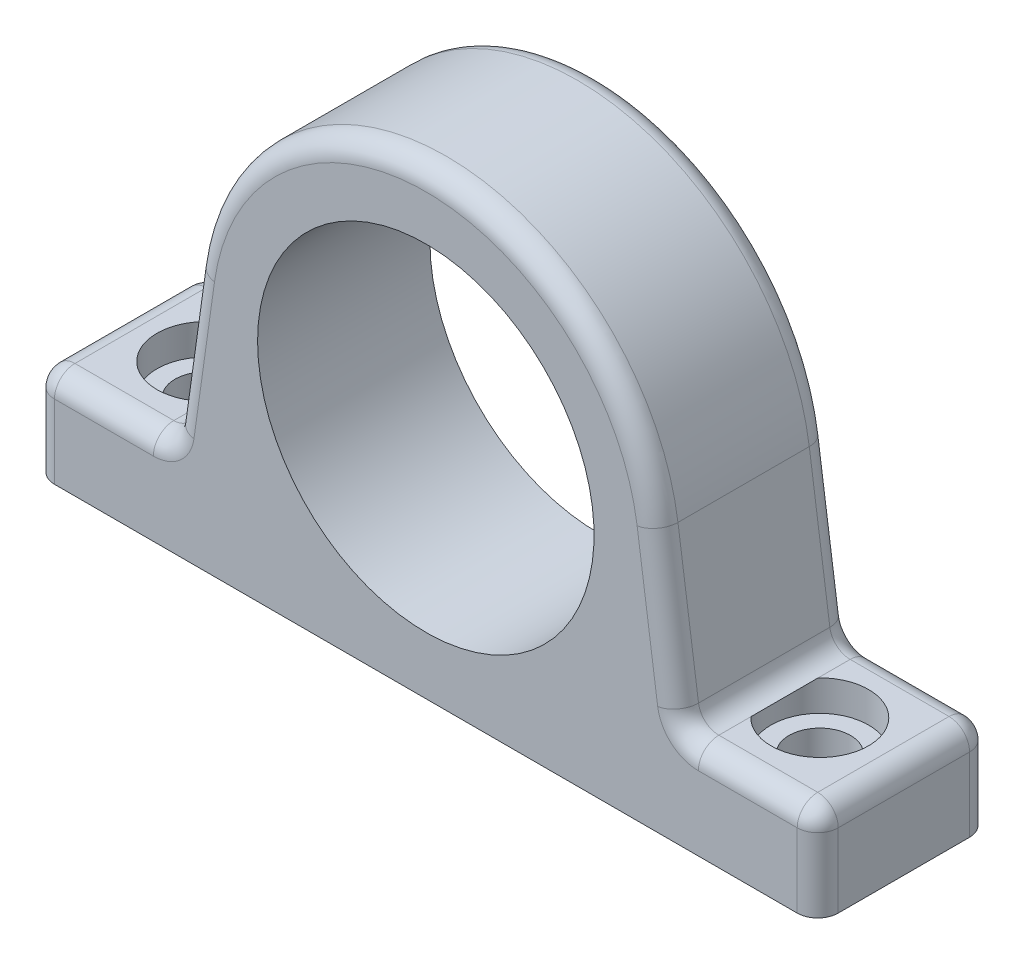
from build123d import *

# Parameters (mm, degrees)
BOSS_EXTRUDE1_DEPTH                        = 42
FILLET1_R                                  = 5
CBORE_FOR_M12_HEX_HEAD_BOLT2_OUTLINE_R     = 7.5
CBORE_FOR_M12_HEX_HEAD_BOLT2_DEPTH         = 23
CBORE_START                                = 15.5
CBORE_FOR_M12_HEX_HEAD_BOLT2_2_OUTLINE_R   = 11.8925
CBORE_FOR_M12_HEX_HEAD_BOLT2_2_OUTLINE_R_2 = 7.5
CBORE_FOR_M12_HEX_HEAD_BOLT2_2_DEPTH       = 7.5


# Read off the part's stored shape, not the designer's step: CBORE for M12 Hex Head Bolt2
with BuildPart() as part:
    # Sketch1 → Boss-Extrude1 (new body)
    with BuildSketch(Plane.XY):
        with BuildLine():
            Line((0, 0), (-95.5, 0))
            Line((-95.5, 0), (-95.5, 23))
            Line((-95.5, 23), (-62.057478344, 23))
            Line((-62.057478344, 23), (-56.445279918, 62.932866755))
            ThreePointArc((-56.445279918, 62.932866755), (-37.395364652, 98.018446073), (0, 112))
            Line((0, 112), (0, 96))
            ThreePointArc((0, 96), (-41, 55), (0, 14))
            Line((0, 14), (0, 0))
        make_face()
    boss_extrude1 = extrude(amount=BOSS_EXTRUDE1_DEPTH)

    # Mirror1: Boss-Extrude1 across plane
    add(boss_extrude1.mirror(Plane(origin=(0, 112, 42), x_dir=(0, 0, 1), z_dir=(-1, 0, 0))))

    # Fillet1
    fillet1_edges = [part.edges().sort_by_distance(p)[0] for p in [
        (0, 112, 0),
        (-95.5, 23, 21),
        (-62.057478344, 23, 21),
        (0, 112, 42),
        (-59.251379131, 42.966433377, 42),
        (95.5, 11.5, 42),
        (-78.778739172, 23, 42),
        (78.778739172, 23, 42),
        (95.5, 23, 21),
        (59.251379131, 42.966433377, 42),
        (62.057478344, 23, 21),
        (59.251379131, 42.966433377, 0),
        (78.778739172, 23, 0),
        (-95.5, 11.5, 42),
        (95.5, 11.5, 0),
        (-95.5, 11.5, 0),
        (-78.778739172, 23, 0),
        (-59.251379131, 42.966433377, 0),
    ]]
    fillet(fillet1_edges, radius=FILLET1_R)

    # CBORE for M12 Hex Head Bolt2 outline → CBORE for M12 Hex Head Bolt2 (cut)
    with BuildSketch(Plane(origin=(0, 0, 0), x_dir=(1, 0, 0), z_dir=(0, 1, 0))):
        with Locations((75, -21)):
            Circle(CBORE_FOR_M12_HEX_HEAD_BOLT2_OUTLINE_R)
        with Locations((-75, -20.635902385)):
            Circle(CBORE_FOR_M12_HEX_HEAD_BOLT2_OUTLINE_R)
    extrude(amount=CBORE_FOR_M12_HEX_HEAD_BOLT2_DEPTH, mode=Mode.SUBTRACT)

    # CBORE for M12 Hex Head Bolt2 2 outline → CBORE for M12 Hex Head Bolt2 2 (cut)
    # profile 1 of 2: a face of its own
    with BuildSketch(Plane(origin=(0, 0, 0), x_dir=(1, 0, 0), z_dir=(0, 1, 0)).offset(CBORE_START)):
        with Locations((75, -21)):
            Circle(CBORE_FOR_M12_HEX_HEAD_BOLT2_2_OUTLINE_R)
        with Locations((75, -21)):
            Circle(CBORE_FOR_M12_HEX_HEAD_BOLT2_2_OUTLINE_R_2, mode=Mode.SUBTRACT)
    # profile 2 of 2: a face of its own
    with BuildSketch(Plane(origin=(0, 0, 0), x_dir=(1, 0, 0), z_dir=(0, 1, 0)).offset(CBORE_START)):
        with Locations((-75, -20.635902385)):
            Circle(CBORE_FOR_M12_HEX_HEAD_BOLT2_2_OUTLINE_R)
        with Locations((-75, -20.635902385)):
            Circle(CBORE_FOR_M12_HEX_HEAD_BOLT2_2_OUTLINE_R_2, mode=Mode.SUBTRACT)
    extrude(amount=CBORE_FOR_M12_HEX_HEAD_BOLT2_2_DEPTH, mode=Mode.SUBTRACT)


solid = part.part
